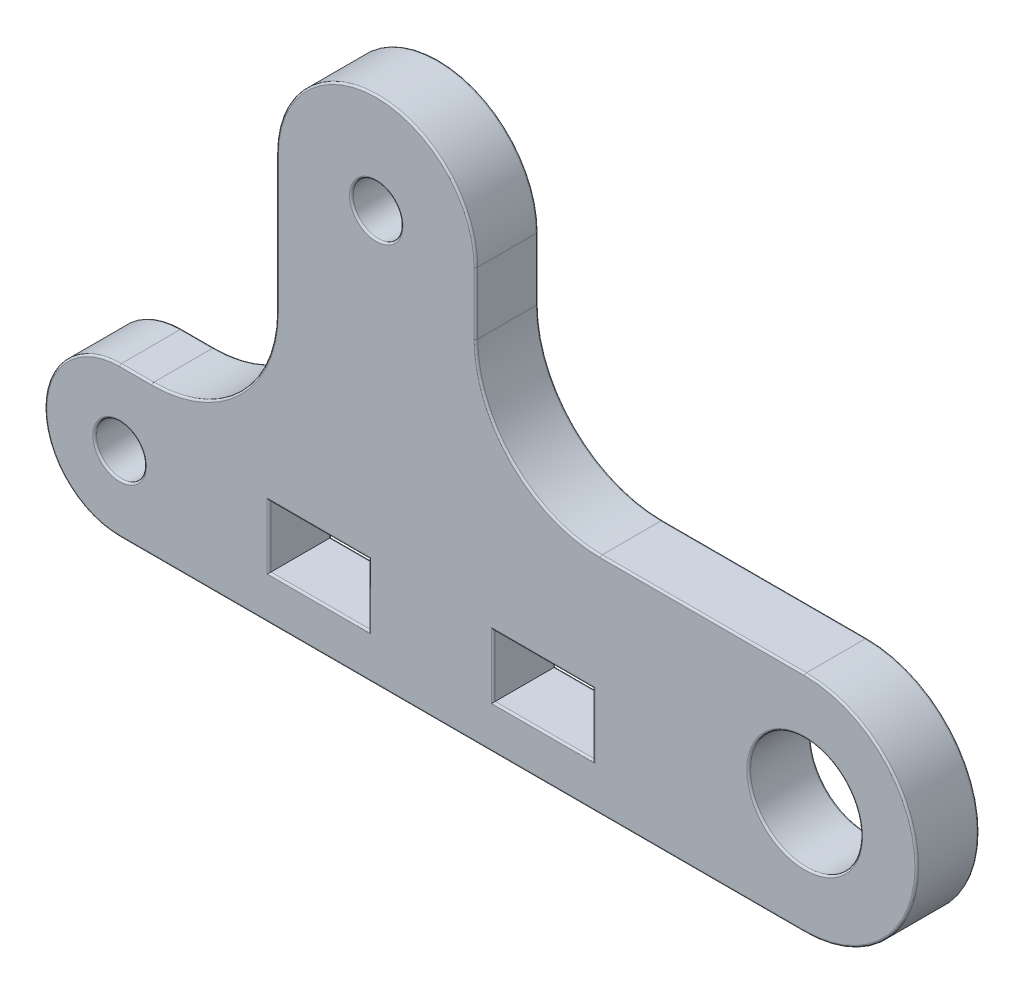
from build123d import *

# Parameters (mm, degrees)
SZKIC1_R                    = 2
SZKIC1_R_2                  = 4.5
SZKIC1_W                    = 8
SZKIC1_H                    = 5
DODANIE_WYCI_GNI_CIE1_DEPTH = 2.5
ZAOKR_GLENIE1_R             = 0.15


with BuildPart() as part:
    # Szkic1 → Dodanie-wyciągnięcie1 (new, symmetric)
    with BuildSketch(Plane.XY):
        with BuildLine():
            Line((-27.5, 0), (27.5, 0))
            ThreePointArc((27.5, 0), (36.5, 9), (27.5, 18))
            Line((27.5, 18), (11.1, 18))
            ThreePointArc((11.1, 18), (4.028932188, 20.928932188), (1.1, 28))
            Line((1.1, 28), (1.1, 33))
            ThreePointArc((1.1, 33), (-6.9, 41), (-14.9, 33))
            Line((-14.9, 33), (-14.9, 22))
            ThreePointArc((-14.9, 22), (-17.828932188, 14.928932188), (-24.9, 12))
            Line((-24.9, 12), (-27.5, 12))
            ThreePointArc((-27.5, 12), (-33.5, 6), (-27.5, 0))
        make_face()
        with Locations((-27.5, 6)):
            Circle(SZKIC1_R, mode=Mode.SUBTRACT)
        with Locations((27.5, 9)):
            Circle(SZKIC1_R_2, mode=Mode.SUBTRACT)
        with Locations((-6.9, 33)):
            Circle(SZKIC1_R, mode=Mode.SUBTRACT)
        with Locations((-11.5, 6)):
            Rectangle(SZKIC1_W, SZKIC1_H, mode=Mode.SUBTRACT)
        with Locations((6.5, 6)):
            Rectangle(SZKIC1_W, SZKIC1_H, mode=Mode.SUBTRACT)
    extrude(amount=DODANIE_WYCI_GNI_CIE1_DEPTH, both=True)

    # Zaokrąglenie1
    zaokr_glenie1_edges = [part.edges().sort_by_distance(p)[0] for p in [
        (10.5, 6, -2.5),
        (6.5, 3.5, -2.5),
        (2.5, 6, -2.5),
        (6.5, 8.5, -2.5),
        (-7.5, 6, -2.5),
        (-11.5, 3.5, -2.5),
        (-15.5, 6, -2.5),
        (-11.5, 8.5, -2.5),
        (-8.9, 33, -2.5),
        (23, 9, -2.5),
        (0, 0, -2.5),
        (36.5, 9, -2.5),
        (19.3, 18, -2.5),
        (4.028932188, 20.928932188, -2.5),
        (1.1, 30.5, -2.5),
        (-6.9, 41, -2.5),
        (-14.9, 27.5, -2.5),
        (-17.828932188, 14.928932188, -2.5),
        (-26.2, 12, -2.5),
        (-33.5, 6, -2.5),
        (-29.5, 6, -2.5),
        (6.5, 3.5, 2.5),
        (10.5, 6, 2.5),
        (6.5, 8.5, 2.5),
        (2.5, 6, 2.5),
        (-8.9, 33, 2.5),
        (-29.5, 6, 2.5),
        (23, 9, 2.5),
        (-26.2, 12, 2.5),
        (-17.828932188, 14.928932188, 2.5),
        (-14.9, 27.5, 2.5),
        (-6.9, 41, 2.5),
        (1.1, 30.5, 2.5),
        (4.028932188, 20.928932188, 2.5),
        (19.3, 18, 2.5),
        (36.5, 9, 2.5),
        (0, 0, 2.5),
        (-33.5, 6, 2.5),
        (-11.5, 3.5, 2.5),
        (-7.5, 6, 2.5),
        (-11.5, 8.5, 2.5),
        (-15.5, 6, 2.5),
    ]]
    fillet(zaokr_glenie1_edges, radius=ZAOKR_GLENIE1_R)


solid = part.part
